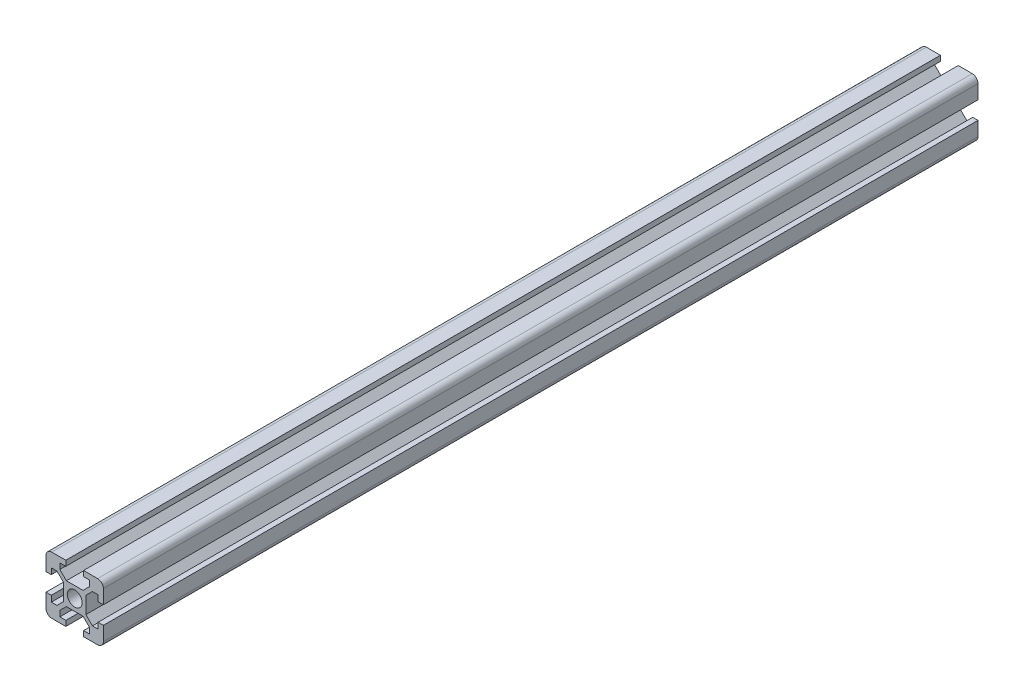
from build123d import *

# Parameters (mm, degrees)
SKETCH1_R           = 2.6
BOSS_EXTRUDE1_DEPTH = 304.8
FILLET1_R           = 2


with BuildPart() as part:
    # Sketch1 → Boss-Extrude1 (new body)
    with BuildSketch(Plane.XY):
        Polygon((-3.9, 2.910050506), (-6.179949494, 5.19), (-8.15, 5.19), (-8.15, 3.1), (-10, 3.1), (-10, 10), (-3.1, 10), (-3.1, 8.15), (-5.19, 8.15), (-5.19, 6.179949494), (-2.910050506, 3.9), (2.910050506, 3.9), (5.19, 6.179949494), (5.19, 8.15), (3.1, 8.15), (3.1, 10), (10, 10), (10, 3.1), (8.15, 3.1), (8.15, 5.19), (6.179949494, 5.19), (3.9, 2.910050506), (3.9, -2.910050506), (6.179949494, -5.19), (8.15, -5.19), (8.15, -3.1), (10, -3.1), (10, -10), (3.1, -10), (3.1, -8.15), (5.19, -8.15), (5.19, -6.179949494), (2.910050506, -3.9), (-2.910050506, -3.9), (-5.19, -6.179949494), (-5.19, -8.15), (-3.1, -8.15), (-3.1, -10), (-10, -10), (-10, -3.1), (-8.15, -3.1), (-8.15, -5.19), (-6.179949494, -5.19), (-3.9, -2.910050506), align=None)
        Circle(SKETCH1_R, mode=Mode.SUBTRACT)
    extrude(amount=-BOSS_EXTRUDE1_DEPTH)

    # Fillet1
    fillet1_edges = [part.edges().sort_by_distance(p)[0] for p in [
        (10, -10, -152.4),
        (-10, -10, -152.4),
        (10, 10, -152.4),
        (-10, 10, -152.4),
    ]]
    fillet(fillet1_edges, radius=FILLET1_R)


solid = part.part
